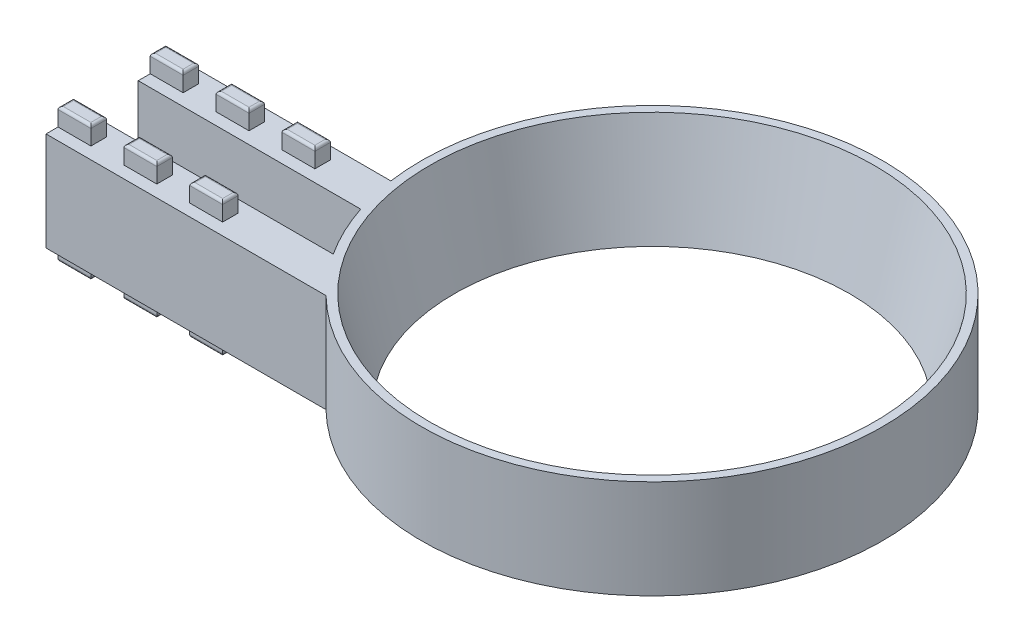
from build123d import *

# Parameters (mm, degrees)
SKETCH1_R            = 44.45
BOSS_EXTRUDE1_DEPTH  = 19.05
BOSS_EXTRUDE2_DEPTH  = 3.175
SKETCH4_W            = 53.981480267
SKETCH4_H            = 15.875
BOSS_EXTRUDE3_DEPTH  = 7.62
SKETCH5_W            = 53.981480267
SKETCH5_H            = 15.875
BOSS_EXTRUDE4_DEPTH  = 7.62
SKETCH2_R            = 38.1
CUT_EXTRUDE1_DEPTH   = 98.872432789
CUT_EXTRUDE1_DRAFT   = 14
SKETCH6_W            = 6.35
SKETCH6_H            = 2.9972
BOSS_EXTRUDE5_DEPTH  = 3.429
FILLET1_R            = 0.508
FILLET1_OF_MIRROR1_R = 0.508


with BuildPart() as part:
    # Sketch1 → Boss-Extrude1 (new body)
    with BuildSketch(Plane(origin=(0, 0, 0), x_dir=(1, 0, 0), z_dir=(0, 1, 0))):
        Circle(SKETCH1_R)
    extrude(amount=BOSS_EXTRUDE1_DEPTH)

    # Sketch3 → Boss-Extrude2 (add)
    with BuildSketch(Plane.XZ):
        with BuildLine():
            Line((-31.108519733, 31.75), (-85.09, 31.75))
            Line((-85.09, 31.75), (-85.09, 6.35))
            Line((-85.09, 6.35), (-43.994090512, 6.35))
            ThreePointArc((-43.994090512, 6.35), (-39.640768363, 20.109997105), (-31.108519733, 31.75))
        make_face()
    extrude(amount=-BOSS_EXTRUDE2_DEPTH)

    # Sketch4 → Boss-Extrude3 (add)
    with BuildSketch(Plane.XY.offset(31.75)):
        with Locations((-58.099259867, 11.1125)):
            Rectangle(SKETCH4_W, SKETCH4_H)
    extrude(amount=-BOSS_EXTRUDE3_DEPTH)

    # Sketch5 → Boss-Extrude4 (add)
    with BuildSketch(Plane(origin=(0, 0, 6.35), x_dir=(-1, 0, 0), z_dir=(0, 0, -1))):
        with Locations((58.099259867, 11.1125)):
            Rectangle(SKETCH5_W, SKETCH5_H)
    extrude(amount=-BOSS_EXTRUDE4_DEPTH)


with BuildPart() as cut_extrude1_tool:
    # Sketch2 → Cut-Extrude1 (with draft: the straight prism first)
    with BuildSketch(Plane.XZ):
        Circle(SKETCH2_R)
    extrude(amount=-CUT_EXTRUDE1_DEPTH)
    # Cut-Extrude1: the draft: its side faces are tilted about the plane it starts from
    cut_extrude1_sides = [cut_extrude1_tool.faces().sort_by_distance(p)[0] for p in [
        (-38.1, 49.436216394, 0),
    ]]
    draft(cut_extrude1_sides, Plane.XZ, CUT_EXTRUDE1_DRAFT)


with BuildPart() as part_1:
    add(part.part)

    # Cut-Extrude1: cut by cut_extrude1_tool
    add(cut_extrude1_tool.part, mode=Mode.SUBTRACT)

    # Sketch6 → Boss-Extrude5 (add)
    with BuildSketch(Plane(origin=(0, 19.05, 0), x_dir=(1, 0, 0), z_dir=(0, 1, 0))):
        with Locations((-81.915, -27.94)):
            Rectangle(SKETCH6_W, SKETCH6_H)
        with Locations((-69.215, -27.94)):
            Rectangle(SKETCH6_W, SKETCH6_H)
        with Locations((-56.515, -27.94)):
            Rectangle(SKETCH6_W, SKETCH6_H)
        with Locations((-56.515, -10.16)):
            Rectangle(SKETCH6_W, SKETCH6_H)
        with Locations((-69.215, -10.16)):
            Rectangle(SKETCH6_W, SKETCH6_H)
        with Locations((-81.915, -10.16)):
            Rectangle(SKETCH6_W, SKETCH6_H)
    boss_extrude5 = extrude(amount=BOSS_EXTRUDE5_DEPTH)

    # Fillet1
    fillet1_edges = [part_1.edges().sort_by_distance(p)[0] for p in [
        (-81.915, 22.479, 8.6614),
        (-78.74, 22.479, 10.16),
        (-81.915, 22.479, 11.6586),
        (-85.09, 22.479, 10.16),
        (-69.215, 22.479, 8.6614),
        (-66.04, 22.479, 10.16),
        (-69.215, 22.479, 11.6586),
        (-72.39, 22.479, 10.16),
        (-56.515, 22.479, 8.6614),
        (-53.34, 22.479, 10.16),
        (-56.515, 22.479, 11.6586),
        (-59.69, 22.479, 10.16),
        (-59.69, 22.479, 27.94),
        (-56.515, 22.479, 26.4414),
        (-53.34, 22.479, 27.94),
        (-56.515, 22.479, 29.4386),
        (-72.39, 22.479, 27.94),
        (-69.215, 22.479, 26.4414),
        (-66.04, 22.479, 27.94),
        (-69.215, 22.479, 29.4386),
        (-81.915, 22.479, 26.4414),
        (-78.74, 22.479, 27.94),
        (-81.915, 22.479, 29.4386),
        (-85.09, 22.479, 27.94),
    ]]
    fillet(fillet1_edges, radius=FILLET1_R)

    # Mirror1: Boss-Extrude5 across plane
    add(boss_extrude5.mirror(Plane.ZX.offset(9.525)))

    # Fillet1 of Mirror1
    fillet1_of_mirror1_edges = [part_1.edges().sort_by_distance(p)[0] for p in [
        (-81.915, -3.429, 8.6614),
        (-78.74, -3.429, 10.16),
        (-81.915, -3.429, 11.6586),
        (-85.09, -3.429, 10.16),
        (-69.215, -3.429, 8.6614),
        (-66.04, -3.429, 10.16),
        (-69.215, -3.429, 11.6586),
        (-72.39, -3.429, 10.16),
        (-56.515, -3.429, 8.6614),
        (-53.34, -3.429, 10.16),
        (-56.515, -3.429, 11.6586),
        (-59.69, -3.429, 10.16),
        (-59.69, -3.429, 27.94),
        (-56.515, -3.429, 26.4414),
        (-53.34, -3.429, 27.94),
        (-56.515, -3.429, 29.4386),
        (-72.39, -3.429, 27.94),
        (-69.215, -3.429, 26.4414),
        (-66.04, -3.429, 27.94),
        (-69.215, -3.429, 29.4386),
        (-81.915, -3.429, 26.4414),
        (-78.74, -3.429, 27.94),
        (-81.915, -3.429, 29.4386),
        (-85.09, -3.429, 27.94),
    ]]
    fillet(fillet1_of_mirror1_edges, radius=FILLET1_OF_MIRROR1_R)


solid = part_1.part
